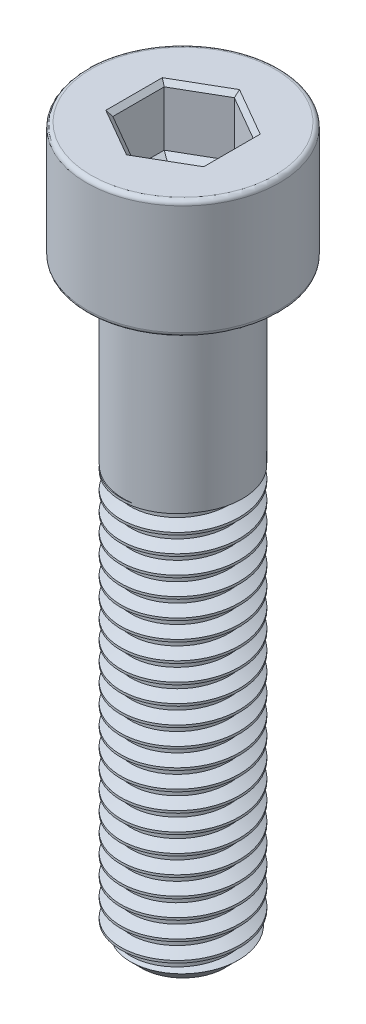
from build123d import *

# Parameters (mm, degrees)
SKETCH1_R           = 4
BOSS_EXTRUDE1_DEPTH = 28
THREAD1_PITCH       = 1.25
SKETCH2_R           = 4
BOSS_EXTRUDE2_DEPTH = 12
SKETCH5_R           = 6.5
BOSS_EXTRUDE3_DEPTH = 8
FILLET1_R           = 0.3
CUT_EXTRUDE1_DEPTH  = 4
CHAMFER1_SIZE       = 0.3
CUT_EXTRUDE2_DEPTH  = 0.4
CUT_EXTRUDE2_DRAFT  = -60


with BuildPart() as part:
    # Sketch1 → Boss-Extrude1 (new body)
    with BuildSketch(Plane(origin=(0, 0, 0), x_dir=(1, 0, 0), z_dir=(0, 1, 0))):
        with Locations(Location((0, 0, 0), (0, 0, 270))):
            Circle(SKETCH1_R)
    extrude(amount=BOSS_EXTRUDE1_DEPTH)

    # Thread1: the profile of Thread Profile1 profile screwed along a right-hand helix of 24 turns, 8 arcs to a turn; built about Z, then put on its axis
    thread1_z = Axis((0, 0, 0), (0, 0, 1))
    thread1_corners = [(4.0003, 0, -0.000173205), (4.0003, 0, 1.093923202), (3.323417656, 0, 0.703124998), (3.323417656, 0, 0.390624998)]
    with BuildLine(mode=Mode.PRIVATE) as thread1_profile:
        Line(thread1_corners[0], thread1_corners[1])
        Line(thread1_corners[1], thread1_corners[2])
        Line(thread1_corners[2], thread1_corners[3])
        Line(thread1_corners[3], thread1_corners[0])
    thread1_cap = Face(thread1_profile.wire())
    thread1_turn_angles = [0, 22.5, 45, 67.5, 90, 112.5, 135, 157.5, 180, 202.5, 225, 247.5, 270, 292.5, 315, 337.5, 360]
    thread1_turn_weights = [1, 0.9238795325112867, 1, 0.9238795325112867, 1, 0.9238795325112867, 1, 0.9238795325112867, 1, 0.9238795325112867, 1, 0.9238795325112867, 1, 0.9238795325112867, 1, 0.9238795325112867, 1]
    thread1_turn_rails = [Edge.make_bspline([Vector(p[0], p[1], 0).rotate(thread1_z, thread1_turn_angles[k]) / thread1_turn_weights[k] + Vector(0, 0, p[2] + THREAD1_PITCH * thread1_turn_angles[k] / 360) for k in range(17)], [0, 0, 0, 1, 1, 2, 2, 3, 3, 4, 4, 5, 5, 6, 6, 7, 7, 8, 8, 8], 2, thread1_turn_weights) for p in thread1_corners]
    thread1_turn_sides = [Face.make_surface_from_curves(thread1_turn_rails[p[0]], thread1_turn_rails[p[1]]) for p in [(0, 1), (1, 2), (2, 3), (3, 0)]]
    thread1 = Plane(origin=(0, 30, 0), x_dir=(-1, 0, 0), z_dir=(0, -1, 0)) * Solid(Shell([*[p.moved(Location((0, 0, THREAD1_PITCH * i))) for i in range(24) for p in thread1_turn_sides], thread1_cap, thread1_cap.rotate(thread1_z, 8640).moved(Location((0, 0, THREAD1_PITCH * 8640 / 360)))]))
    add(thread1, mode=Mode.SUBTRACT)

    # Sketch2 → Boss-Extrude2 (add)
    with BuildSketch(Plane(origin=(0, 28, 0), x_dir=(1, 0, 0), z_dir=(0, 1, 0))):
        with Locations(Location((0, 0, 0), (0, 0, 117.593571361))):
            Circle(SKETCH2_R)
    extrude(amount=BOSS_EXTRUDE2_DEPTH)

    # Sketch5 → Boss-Extrude3 (add)
    with BuildSketch(Plane(origin=(0, 40, 0), x_dir=(1, 0, 0), z_dir=(0, 1, 0))):
        with Locations(Location((0, 0, 0), (0, 0, 270))):
            Circle(SKETCH5_R)
    extrude(amount=BOSS_EXTRUDE3_DEPTH)

    # Sketch6 → Cut-Revolve1 (revolve, cut)
    with BuildSketch(Plane.XY, mode=Mode.PRIVATE) as cut_revolve1_sk:
        Polygon((4.01, 0), (4.01, 1.2), (2.81, 0), align=None)
    revolve(cut_revolve1_sk.sketch.rotate(Axis((0, 0, 0), (0, 1, 0)), 117.593571361), axis=Axis((0, 0, 0), (0, 1, 0)), mode=Mode.SUBTRACT)

    # Fillet1
    fillet1_edges = [part.edges().sort_by_distance(p)[0] for p in [
        (0, 40, -6.5),
        (0, 48, -6.5),
    ]]
    fillet(fillet1_edges, radius=FILLET1_R)

    # Sketch7 → Cut-Extrude1 (cut)
    with BuildSketch(Plane(origin=(0, 48, 0), x_dir=(1, 0, 0), z_dir=(0, 1, 0))):
        Polygon((0, 3.464101615), (-3, 1.732050808), (-3, -1.732050808), (0, -3.464101615), (3, -1.732050808), (3, 1.732050808), align=None)
    extrude(amount=-CUT_EXTRUDE1_DEPTH, mode=Mode.SUBTRACT)

    # Chamfer1
    chamfer1_edges = [part.edges().sort_by_distance(p)[0] for p in [
        (1.5, 48, -2.598076211),
        (-1.5, 48, -2.598076211),
        (-3, 48, 0),
        (-1.5, 48, 2.598076211),
        (1.5, 48, 2.598076211),
        (3, 48, 0),
    ]]
    chamfer(chamfer1_edges, length=CHAMFER1_SIZE)


with BuildPart() as cut_extrude2_tool:
    # Sketch8 → Cut-Extrude2 (with draft: the straight prism first)
    with BuildSketch(Plane(origin=(0, 44, 0), x_dir=(1, 0, 0), z_dir=(0, 1, 0))):
        Polygon((0, 3.464101615), (-3, 1.732050808), (-3, -1.732050808), (0, -3.464101615), (3, -1.732050808), (3, 1.732050808), align=None)
    extrude(amount=-CUT_EXTRUDE2_DEPTH)
    # Cut-Extrude2: the draft: its side faces are tilted about the plane it starts from
    cut_extrude2_sides = [cut_extrude2_tool.faces().sort_by_distance(p)[0] for p in [
        (-1.5, 43.8, -2.598076211),
        (-3, 43.8, 0),
        (-1.5, 43.8, 2.598076211),
        (1.5, 43.8, 2.598076211),
        (3, 43.8, 0),
        (1.5, 43.8, -2.598076211),
    ]]
    draft(cut_extrude2_sides, Plane(origin=(0, 44, 0), x_dir=(1, 0, 0), z_dir=(0, 1, 0)), CUT_EXTRUDE2_DRAFT)


with BuildPart() as part_1:
    add(part.part)

    # Cut-Extrude2: cut by cut_extrude2_tool
    add(cut_extrude2_tool.part, mode=Mode.SUBTRACT)


solid = part_1.part
